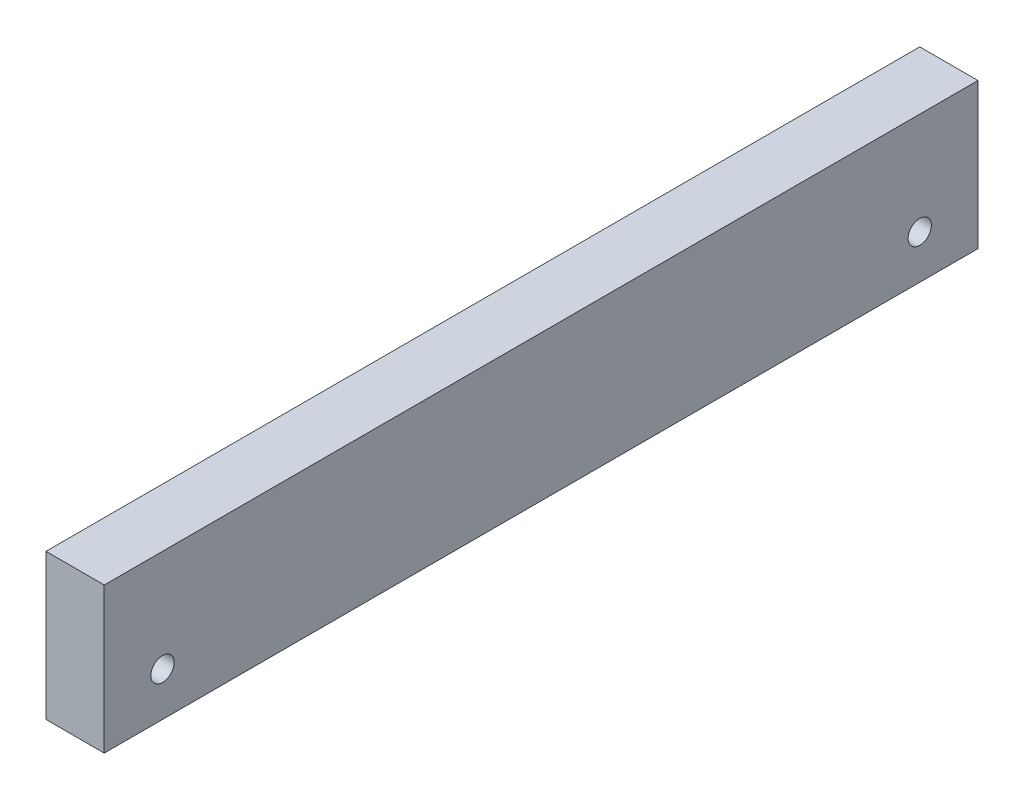
from build123d import *

# Parameters (mm, degrees)
SKETCH1_W                = 20
SKETCH1_H                = 50
EXTRUDE1_DEPTH           = 300
F_8_0_8_DIAMETER_HOLE1_D = 8


with BuildPart() as part:
    # Sketch1 → Extrude1 (new body)
    with BuildSketch(Plane.XY):
        with Locations((10, 25)):
            Rectangle(SKETCH1_W, SKETCH1_H)
    extrude(amount=EXTRUDE1_DEPTH)

    # Ø8.0 (8) Diameter Hole1 (through all)
    with Locations(Plane(origin=(20, 15, 280), x_dir=(0, 0, 1), z_dir=(1, 0, 0))):
        with Locations((0, 0), (-260, 0)):
            Hole(F_8_0_8_DIAMETER_HOLE1_D / 2)


solid = part.part
